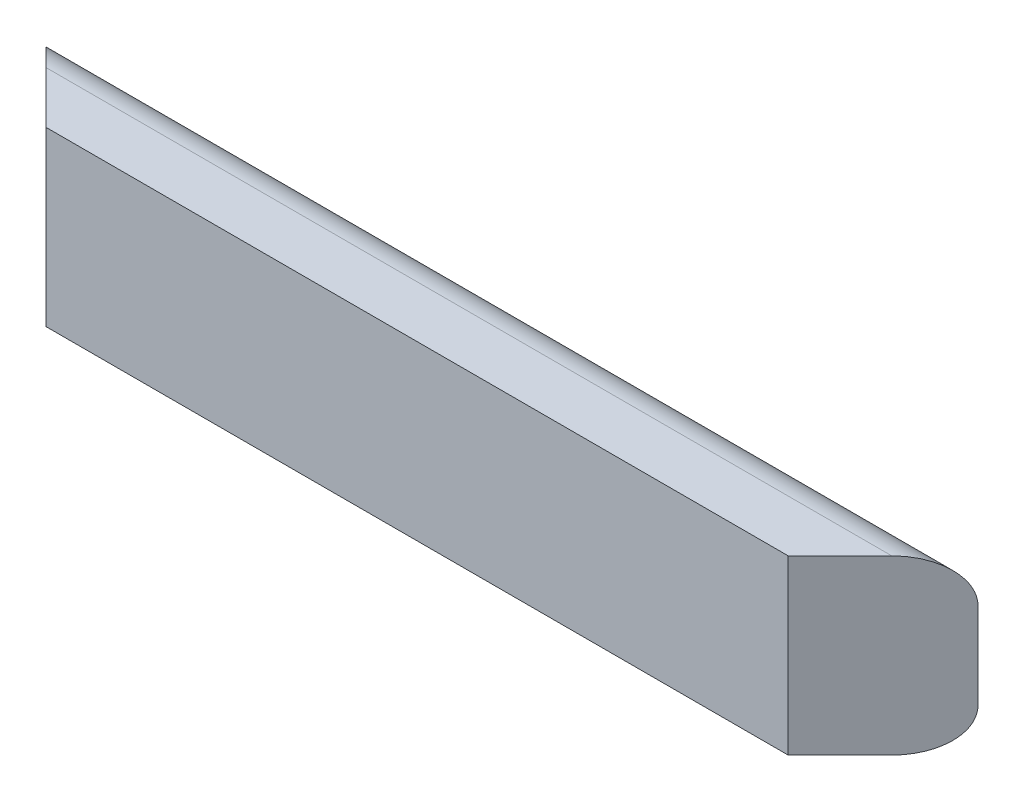
from build123d import *

# Parameters (mm, degrees)
BOSS_EXTRUDE1_DEPTH      = 342.9
BOSS_EXTRUDE1_DEPTH_BACK = 342.9
CUT_EXTRUDE1_DEPTH       = 373.27467346


with BuildPart() as part:
    # Sketch1 → Boss-Extrude1 (new, two sides: drawn at the far end of the back side and taken through both)
    with BuildSketch(Plane(origin=(0, 0, 0), x_dir=(0, 0, -1), z_dir=(1, 0, 0)).offset(-BOSS_EXTRUDE1_DEPTH_BACK)):
        with BuildLine():
            Line((6.35, 127), (38.1, 127))
            ThreePointArc((38.1, 127), (60.550640303, 117.700640303), (69.85, 95.25))
            Line((69.85, 95.25), (69.85, 31.75))
            ThreePointArc((69.85, 31.75), (60.550640303, 9.299359697), (38.1, 0))
            Line((38.1, 0), (6.35, 0))
            Line((6.35, 0), (0, 0))
            Line((0, 0), (0, 127))
            Line((0, 127), (6.35, 127))
        make_face()
    extrude(amount=BOSS_EXTRUDE1_DEPTH + BOSS_EXTRUDE1_DEPTH_BACK)

    # Sketch2 → Cut-Extrude1 (cut, through all)
    with BuildSketch(Plane(origin=(0, 127, 0), x_dir=(1, 0, 0), z_dir=(0, 1, 0))):
        Polygon((342.9, 69.85), (273.05, 0), (342.9, 0), align=None)
        Polygon((-342.9, 69.85), (-273.05, 0), (-342.9, 0), align=None)
    extrude(amount=-CUT_EXTRUDE1_DEPTH, mode=Mode.SUBTRACT)


solid = part.part
